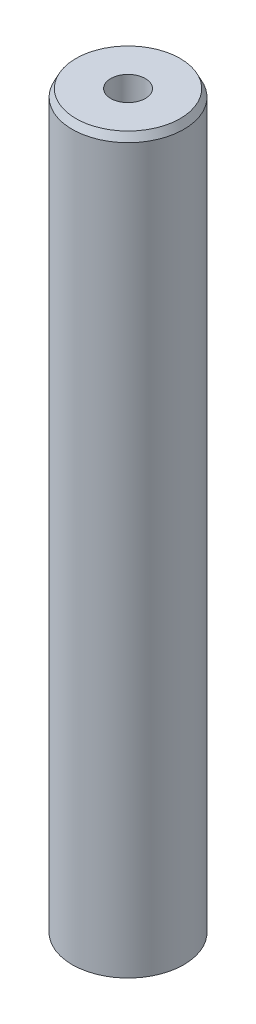
from build123d import *
from OCP.BRepFilletAPI import BRepFilletAPI_MakeChamfer

# Parameters (mm, degrees)
SKETCH1_R           = 5
BOSS_EXTRUDE1_DEPTH = 65.782192569
SKETCH2_R           = 1.549613744
CUT_EXTRUDE1_DEPTH  = 67.161143122
CHAMFER1_SIZE       = 0.667405839
CHAMFER1_SIZE2      = 0.332589931


with BuildPart() as part:
    # Sketch1 → Boss-Extrude1 (new body)
    with BuildSketch(Plane(origin=(0, 0, 0), x_dir=(1, 0, 0), z_dir=(0, 1, 0))):
        Circle(SKETCH1_R)
    extrude(amount=BOSS_EXTRUDE1_DEPTH)

    # Sketch2 → Cut-Extrude1 (cut, through all)
    with BuildSketch(Plane(origin=(0, 0, 0), x_dir=(1, 0, 0), z_dir=(0, 1, 0))):
        Circle(SKETCH2_R)
    extrude(amount=CUT_EXTRUDE1_DEPTH, mode=Mode.SUBTRACT)

    # Chamfer1: one chamfer whose edges measure the first distance from different faces: ONE call of the kernel's chamfer builder (chamfer() names one face for all edges)
    chamfer1_edges_1 = [part.edges().sort_by_distance(p)[0] for p in [
        (-5, 65.782192569, 0),
    ]]
    chamfer1_side_1 = [part.faces().sort_by_distance(p)[0] for p in [
        (-5, 32.891096285, 0),
    ]]
    chamfer1_edges_2 = [part.edges().sort_by_distance(p)[0] for p in [
        (-5, 0, 0),
    ]]
    chamfer1_side_2 = [part.faces().sort_by_distance(p)[0] for p in [
        (-4.858578644, 0, 0),
    ]]
    chamfer1 = BRepFilletAPI_MakeChamfer(part.part.solid().wrapped)
    for e in chamfer1_edges_1:
        chamfer1.Add(CHAMFER1_SIZE, CHAMFER1_SIZE2, e.wrapped, chamfer1_side_1[0].wrapped)  # the first distance lies on this face
    for e in chamfer1_edges_2:
        chamfer1.Add(CHAMFER1_SIZE, CHAMFER1_SIZE2, e.wrapped, chamfer1_side_2[0].wrapped)  # the first distance lies on this face
    add(Compound.cast(chamfer1.Shape()), mode=Mode.REPLACE)


solid = part.part
